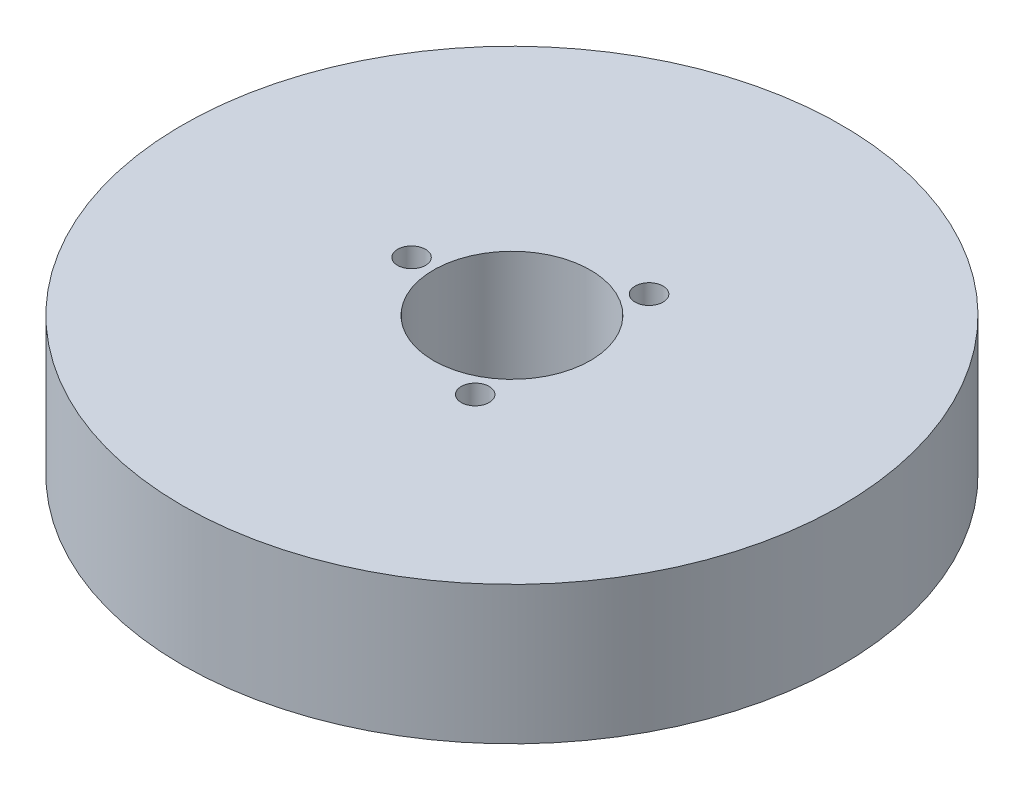
from build123d import *

# Parameters (mm, degrees)
SKETCH1_R           = 52.5
BOSS_EXTRUDE1_DEPTH = 22
SKETCH2_R           = 12.5
CUT_EXTRUDE1_DEPTH  = 78.437071226
SKETCH3_R           = 2.226043152
CUT_EXTRUDE2_DEPTH  = 15.431271762
CIRPATTERN1_COUNT   = 3


with BuildPart() as part:
    # Sketch1 → Boss-Extrude1 (new body)
    with BuildSketch(Plane(origin=(0, 0, 0), x_dir=(1, 0, 0), z_dir=(0, 1, 0))):
        Circle(SKETCH1_R)
    extrude(amount=BOSS_EXTRUDE1_DEPTH)

    # Sketch2 → Cut-Extrude1 (cut, through all)
    with BuildSketch(Plane(origin=(0, 0, 0), x_dir=(1, 0, 0), z_dir=(0, 1, 0))):
        Circle(SKETCH2_R)
    extrude(amount=CUT_EXTRUDE1_DEPTH, mode=Mode.SUBTRACT)

    # Sketch3 → Cut-Extrude2 (cut)
    with BuildSketch(Plane(origin=(0, 22, 0), x_dir=(1, 0, 0), z_dir=(0, 1, 0))):
        with Locations((-15.992548242, 0)):
            Circle(SKETCH3_R)
    cut_extrude2 = extrude(amount=-CUT_EXTRUDE2_DEPTH, mode=Mode.SUBTRACT)

    # CirPattern1: Cut-Extrude2 ×3 about axis
    cirpattern1_axis = Axis((0, 0, 0), (0, 1, 0))
    for i in range(1, CIRPATTERN1_COUNT):
        add(cut_extrude2.rotate(cirpattern1_axis, i * 360 / CIRPATTERN1_COUNT), mode=Mode.SUBTRACT)


solid = part.part
